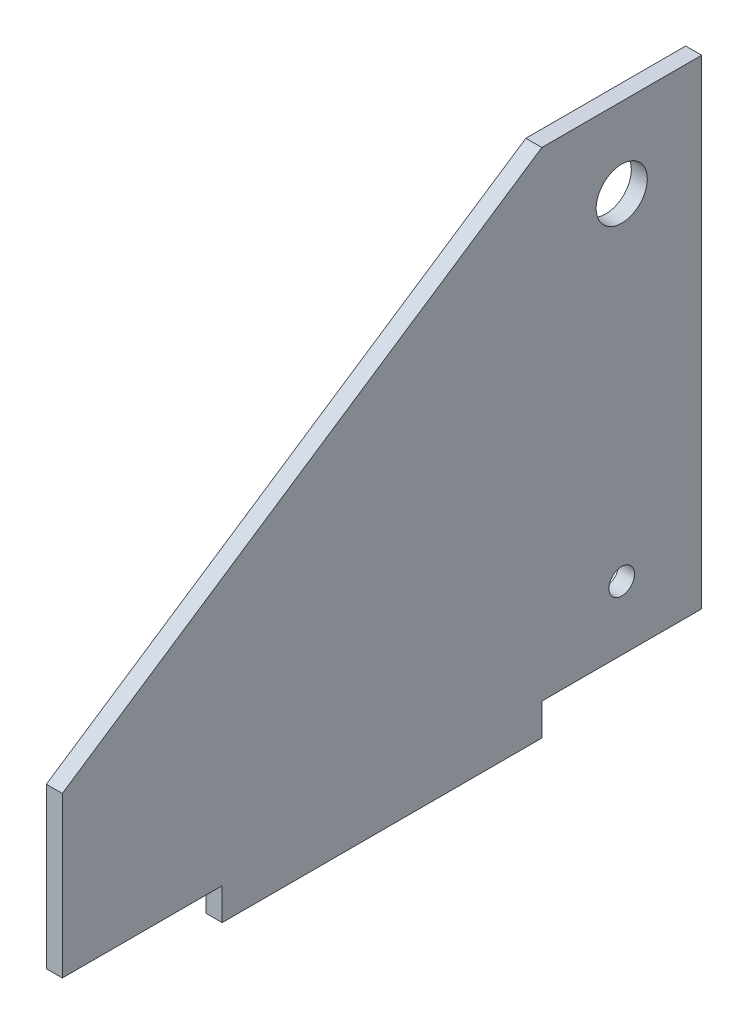
from build123d import *

# Parameters (mm, degrees)
CROQUIS1_R              = 8
CROQUIS1_R_2            = 4
SALIENTE_EXTRUIR1_DEPTH = 5


with BuildPart() as part:
    # Croquis1 → Saliente-Extruir1 (new body)
    with BuildSketch(Plane(origin=(0, 0, 0), x_dir=(0, 0, -1), z_dir=(1, 0, 0))):
        Polygon((50, 75), (-100, -25), (-100, -75), (-50, -75), (-50, -85), (50, -85), (50, -75), (100, -75), (100, 75), align=None)
        with Locations((75, 50)):
            Circle(CROQUIS1_R, mode=Mode.SUBTRACT)
        with Locations((75, -55)):
            Circle(CROQUIS1_R_2, mode=Mode.SUBTRACT)
    extrude(amount=SALIENTE_EXTRUIR1_DEPTH)


solid = part.part
